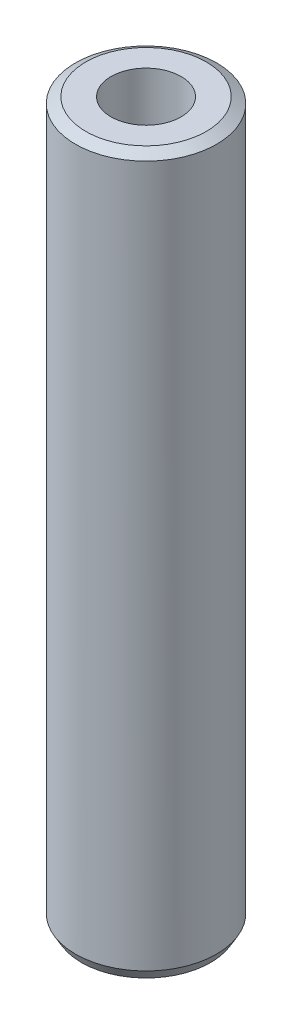
from build123d import *
from OCP.BRepFilletAPI import BRepFilletAPI_MakeChamfer

# Parameters (mm, degrees)
SKETCH1_R           = 35
BOSS_EXTRUDE1_DEPTH = 355.896720853
SKETCH2_R           = 17.370729122
CUT_EXTRUDE1_DEPTH  = 360.322245225
CHAMFER1_SIZE       = 2.951972409
CHAMFER1_SIZE2      = 5.112966195


with BuildPart() as part:
    # Sketch1 → Boss-Extrude1 (new body)
    with BuildSketch(Plane(origin=(0, 0, 0), x_dir=(1, 0, 0), z_dir=(0, 1, 0))):
        Circle(SKETCH1_R)
    extrude(amount=BOSS_EXTRUDE1_DEPTH)

    # Sketch2 → Cut-Extrude1 (cut, through all)
    with BuildSketch(Plane(origin=(0, 0, 0), x_dir=(1, 0, 0), z_dir=(0, 1, 0))):
        Circle(SKETCH2_R)
    extrude(amount=CUT_EXTRUDE1_DEPTH, mode=Mode.SUBTRACT)

    # Chamfer1: one chamfer whose edges measure the first distance from different faces: ONE call of the kernel's chamfer builder (chamfer() names one face for all edges)
    chamfer1_edges_1 = [part.edges().sort_by_distance(p)[0] for p in [
        (-35, 355.896720853, 0),
    ]]
    chamfer1_side_1 = [part.faces().sort_by_distance(p)[0] for p in [
        (-35, 177.948360426, 0),
    ]]
    chamfer1_edges_2 = [part.edges().sort_by_distance(p)[0] for p in [
        (-35, 0, 0),
    ]]
    chamfer1_side_2 = [part.faces().sort_by_distance(p)[0] for p in [
        (-34.010050506, 0, 0),
    ]]
    chamfer1 = BRepFilletAPI_MakeChamfer(part.part.solid().wrapped)
    for e in chamfer1_edges_1:
        chamfer1.Add(CHAMFER1_SIZE, CHAMFER1_SIZE2, e.wrapped, chamfer1_side_1[0].wrapped)  # the first distance lies on this face
    for e in chamfer1_edges_2:
        chamfer1.Add(CHAMFER1_SIZE, CHAMFER1_SIZE2, e.wrapped, chamfer1_side_2[0].wrapped)  # the first distance lies on this face
    add(Compound.cast(chamfer1.Shape()), mode=Mode.REPLACE)


solid = part.part
